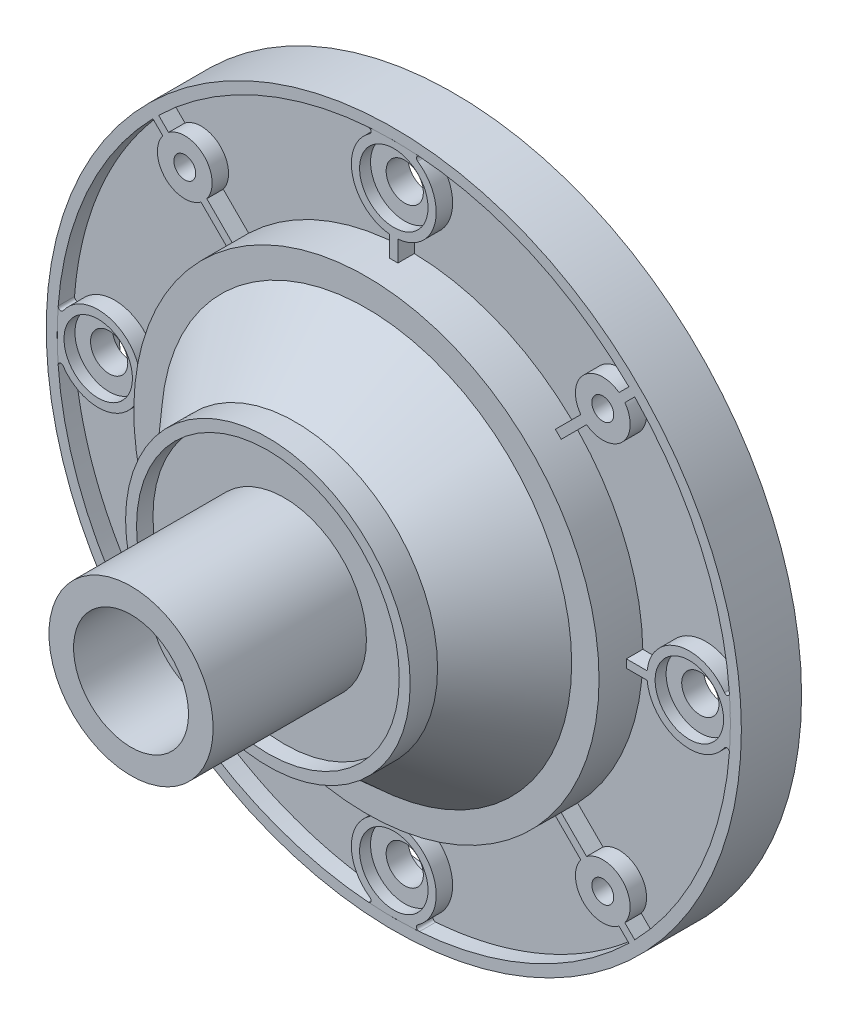
from build123d import *
from build123d.topology import SkipClean

# Parameters (mm, degrees)
SKETCH_1_R                = 63.5
EXTRUDE_1_DEPTH           = 11
SKETCH_2_R                = 42.5
EXTRUDE_2_DEPTH           = 5
SKETCH_3_R                = 26
EXTRUDE_3_DEPTH           = 18
SKETCH_4_R                = 37.5
SKETCH_5_R                = 26
SKETCH_6_R                = 15
EXTRUDE_4_DEPTH           = 25
SKETCH_7_R                = 61.5
CUT_EXTRUDE_1_DEPTH       = 6
SKETCH_9_R                = 37.5
SKETCH_9_R_2              = 35.5
EXTRUDE_1_2_DEPTH         = 3
SKETCH_12_R               = 12
EXTRUDE_5_DEPTH           = 19
SKETCH_13_R               = 8.5
CUT_EXTRUDE_3_DEPTH       = 103.301026388
SKETCH_14_R               = 10.5
CUT_EXTRUDE_4_DEPTH       = 14
CUT_EXTRUDE_START         = -3
SKETCH_15_R               = 24
SKETCH_15_R_2             = 15
CUT_EXTRUDE_5_DEPTH       = 3
CUT_EXTRUDE_START_2       = -8
SKETCH_16_R               = 40.5
SKETCH_16_R_2             = 37.5
CUT_EXTRUDE_6_DEPTH       = 8
SKETCH_17_R               = 61.5
SKETCH_17_R_2             = 42.5
CUT_EXTRUDE_7_DEPTH       = 3
SKETCH_18_R               = 5
EXTRUDE_6_DEPTH           = 3
RIB_1_REACH               = 109.45
SKETCH_19_WALL_W          = 220.843959406
SKETCH_19_WALL_H          = 1.5
SKETCH_20_W               = 19.666237603
SKETCH_20_H               = 3
EXTRUDE_2_2_DEPTH         = 0.75
PATTERN_CIRCULAR_2_COUNT  = 4
HOLE_WIZARD_1_D           = 6.8
HOLE_WIZARD_1_CBORE_D     = 12.5
HOLE_WIZARD_1_CBORE_DEPTH = 2
HOLE_WIZARD_2_D           = 4
EXTRUDE_START             = 1
SKETCH_26_R               = 5.25
SKETCH_26_R_2             = 3.4
EXTRUDE_7_DEPTH           = 1
PATTERN_CIRCULAR_3_COUNT  = 4
RIB_4_REACH               = 109.45
SKETCH_29_WALL_W          = 241.801402874
SKETCH_29_WALL_H          = 1
PATTERN_CIRCULAR_4_COUNT  = 8
EXTRUDE_8_DEPTH           = 12
PATTERN_CIRCULAR_5_COUNT  = 4


# Read off the part's stored shape, not the designer's step: 切除-拉伸2
with BuildPart() as part:
    # 草图1 → Extrude 1 (new body)
    with BuildSketch(Plane.XY):
        Circle(SKETCH_1_R)
    extrude(amount=EXTRUDE_1_DEPTH)

    # 草图2 → Extrude 2 (add)
    with BuildSketch(Plane.XY.offset(11)):
        Circle(SKETCH_2_R)
    extrude(amount=EXTRUDE_2_DEPTH)

    # 草图3 → 凸台-拉伸3 (add)
    with BuildSketch(Plane.XY.offset(16)):
        Circle(SKETCH_3_R)
    extrude(amount=EXTRUDE_3_DEPTH)

    # 草图4 → 放样1 section 0
    with BuildSketch(Plane.XY.offset(16)):
        Circle(SKETCH_4_R)
    # 草图5 → 放样1 section 1
    with BuildSketch(Plane.XY.offset(29)):
        Circle(SKETCH_5_R)
    loft()

    # 草图6 → 凸台-拉伸4 (add)
    with BuildSketch(Plane.XY.offset(34)):
        Circle(SKETCH_6_R)
    extrude(amount=EXTRUDE_4_DEPTH)

    # 草图7 → 切除-拉伸1 (cut)
    with BuildSketch(Plane(origin=(0, 0, 0), x_dir=(-1, 0, 0), z_dir=(0, 0, -1))):
        Circle(SKETCH_7_R)
    extrude(amount=-CUT_EXTRUDE_1_DEPTH, mode=Mode.SUBTRACT)

    # 草图9 → Extrude 1 2 (add)
    with BuildSketch(Plane(origin=(0, 0, 6), x_dir=(-1, 0, 0), z_dir=(0, 0, -1))):
        Circle(SKETCH_9_R)
        Circle(SKETCH_9_R_2, mode=Mode.SUBTRACT)
    extrude(amount=EXTRUDE_1_2_DEPTH)

    # 切除-拉伸2 outline → 切除-拉伸2 (revolve, cut)
    with SkipClean():  # the faces are left unmerged after this step: merging them gives an invalid solid
        with BuildSketch(Plane.XZ):
            Polygon((0, 6), (35.5, 6), (35.5, 15.242338268), (23.329760776, 29), (0, 29), align=None)
        revolve(axis=Axis((0, 0, 0), (0, 0, 1)), mode=Mode.SUBTRACT)

    # 草图12 → 凸台-拉伸5 (add)
    with SkipClean():  # the faces are left unmerged after this step: merging them gives an invalid solid
        with BuildSketch(Plane(origin=(0, 0, 29), x_dir=(-1, 0, 0), z_dir=(0, 0, -1))):
            Circle(SKETCH_12_R)
        extrude(amount=EXTRUDE_5_DEPTH)

    # 草图13 → 切除-拉伸3 (cut, through all)
    with SkipClean():  # the faces are left unmerged after this step: merging them gives an invalid solid
        with BuildSketch(Plane(origin=(0, 0, 10), x_dir=(-1, 0, 0), z_dir=(0, 0, -1))):
            Circle(SKETCH_13_R)
        extrude(amount=-CUT_EXTRUDE_3_DEPTH, mode=Mode.SUBTRACT)

    # 草图14 → 切除-拉伸4 (cut)
    with SkipClean():  # the faces are left unmerged after this step: merging them gives an invalid solid
        with BuildSketch(Plane.XY.offset(59)):
            Circle(SKETCH_14_R)
        extrude(amount=-CUT_EXTRUDE_4_DEPTH, mode=Mode.SUBTRACT)

    # 草图15 → 切除-拉伸5 (cut)
    with SkipClean():  # the faces are left unmerged after this step: merging them gives an invalid solid
        with BuildSketch(Plane.XY.offset(34).offset(CUT_EXTRUDE_START)):
            Circle(SKETCH_15_R)
            Circle(SKETCH_15_R_2, mode=Mode.SUBTRACT)
        extrude(amount=CUT_EXTRUDE_5_DEPTH, mode=Mode.SUBTRACT)

    # 草图16 → 切除-拉伸6 (cut)
    with SkipClean():  # the faces are left unmerged after this step: merging them gives an invalid solid
        with BuildSketch(Plane(origin=(0, 0, 6), x_dir=(-1, 0, 0), z_dir=(0, 0, -1)).offset(CUT_EXTRUDE_START_2)):
            Circle(SKETCH_16_R)
            with Locations(Location((0, 0, 0), (0, 0, 180))):
                Circle(SKETCH_16_R_2, mode=Mode.SUBTRACT)
        extrude(amount=CUT_EXTRUDE_6_DEPTH, mode=Mode.SUBTRACT)

    # 草图17 → 切除-拉伸7 (cut)
    with BuildSketch(Plane.XY.offset(11).offset(CUT_EXTRUDE_START)):
        with Locations(Location((0, 0, 0), (0, 0, 180))):
            Circle(SKETCH_17_R)
        Circle(SKETCH_17_R_2, mode=Mode.SUBTRACT)
    extrude(amount=CUT_EXTRUDE_7_DEPTH, mode=Mode.SUBTRACT)

    # 草图18 → 凸台-拉伸6 (add)
    with BuildSketch(Plane.XY.offset(8)):
        with Locations((-38.183766184, 38.183766184)):
            Circle(SKETCH_18_R)
        with BuildLine():
            ThreePointArc((-4.364482597, 60.404201094), (-5.23e-06, 46.25), (4.364491241, 60.404195204))
            ThreePointArc((4.364491241, 60.404195204), (4.172729373, 60.978451055), (4.674967073, 61.316533425))
            ThreePointArc((4.674967073, 61.316533425), (0.000154332, 61.494492342), (-4.674659303, 61.31655689))
            ThreePointArc((-4.674659303, 61.31655689), (-4.17267191, 60.97831544), (-4.364482597, 60.404201094))
        make_face()
    extrude_6 = extrude(amount=EXTRUDE_6_DEPTH)

    # 草图19 wall → 筋1 (add, up to next)
    with BuildSketch(Plane(origin=(0, 44.278008664, 11), x_dir=(0, -1, 0), z_dir=(0, 0, -1)), mode=Mode.PRIVATE) as rib_1_sk1:
        Rectangle(SKETCH_19_WALL_W, SKETCH_19_WALL_H)
    rib_1_tool1 = extrude(rib_1_sk1.sketch, amount=RIB_1_REACH, mode=Mode.PRIVATE) - part.part
    rib_1 = rib_1_tool1.solids().sort_by_distance((0, 44.278008664, 11))[0]
    add(rib_1)

    # 草图20 → Extrude 2 2 (add, symmetric)
    with BuildSketch(Plane(origin=(0, 0, 0), x_dir=(-0.7071067811865487, 0.7071067811865465, 0), z_dir=(-0.7071067811865465, -0.7071067811865487, 0))):
        with Locations((51.80063815, -9.5)):
            Rectangle(SKETCH_20_W, SKETCH_20_H)
    extrude_2_2 = extrude(amount=EXTRUDE_2_2_DEPTH, both=True)

    # 阵列(圆周)2: 凸台-拉伸6, 筋1, Extrude 2 2 ×4 about axis
    pattern_circular_2_axis = Axis((0, 0, 0), (0, 0, 1))
    add([extrude_6.rotate(pattern_circular_2_axis, i * 360 / PATTERN_CIRCULAR_2_COUNT) for i in range(1, PATTERN_CIRCULAR_2_COUNT)])
    add([rib_1.rotate(pattern_circular_2_axis, i * 360 / PATTERN_CIRCULAR_2_COUNT) for i in range(1, PATTERN_CIRCULAR_2_COUNT)])
    add([extrude_2_2.rotate(pattern_circular_2_axis, i * 360 / PATTERN_CIRCULAR_2_COUNT) for i in range(1, PATTERN_CIRCULAR_2_COUNT)])

    # 孔1 (through all)
    with Locations(Plane.XY.offset(11)):
        with Locations((0, 54), (54, 0), (0, -54), (-54, 0)):
            CounterBoreHole(HOLE_WIZARD_1_D / 2, HOLE_WIZARD_1_CBORE_D / 2, HOLE_WIZARD_1_CBORE_DEPTH)

    # 孔2 (through all)
    with Locations(Plane.XY.offset(11)):
        with Locations((38.183766184, 38.183766184), (38.183766184, -38.183766184), (-38.183766184, -38.183766184), (-38.183766184, 38.183766184)):
            Hole(HOLE_WIZARD_2_D / 2)

    # 草图26 → 凸台-拉伸7 (add)
    with BuildSketch(Plane(origin=(0, 0, 6), x_dir=(-1, 0, 0), z_dir=(0, 0, -1)).offset(EXTRUDE_START)):
        with Locations((0, 54)):
            Circle(SKETCH_26_R)
        with Locations(Location((0, 54, 0), (0, 0, 180))):
            Circle(SKETCH_26_R_2, mode=Mode.SUBTRACT)
    extrude_7 = extrude(amount=-EXTRUDE_7_DEPTH)

    # 阵列(圆周)3: 凸台-拉伸7 ×4 about axis
    with SkipClean():  # the faces are left unmerged after this step: merging them gives an invalid solid
        pattern_circular_3_axis = Axis((0, 0, 0), (0, 0, 1))
        for i in range(1, PATTERN_CIRCULAR_3_COUNT):
            add(extrude_7.rotate(pattern_circular_3_axis, i * 360 / PATTERN_CIRCULAR_3_COUNT))

    # 草图29 wall → 筋4 (add, up to next)
    with BuildSketch(Plane(origin=(0, 24.018719671, 11), x_dir=(0, 1, 0), z_dir=(0, 0, 1)), mode=Mode.PRIVATE) as rib_4_sk1:
        Rectangle(SKETCH_29_WALL_W, SKETCH_29_WALL_H)
    rib_4_tool1 = extrude(rib_4_sk1.sketch, amount=RIB_4_REACH, mode=Mode.PRIVATE) - part.part
    rib_4 = rib_4_tool1.solids().sort_by_distance((0, 24.018719671, 11))[0]
    add(rib_4)

    # 阵列(圆周)4: 筋4 ×8 about axis
    with SkipClean():  # the faces are left unmerged after this step: merging them gives an invalid solid
        pattern_circular_4_axis = Axis((0, 0, 0), (0, 0, 1))
        for i in range(1, PATTERN_CIRCULAR_4_COUNT):
            add(rib_4.rotate(pattern_circular_4_axis, i * 360 / PATTERN_CIRCULAR_4_COUNT))
    add(part.part.scale(1), mode=Mode.REPLACE)  # the faces are merged on a copy

    # 草图30 → 凸台-拉伸8 (add)
    with BuildSketch(Plane.XY.offset(3)):
        with BuildLine():
            ThreePointArc((-28.387596195, 21.316528383), (-25.102290732, 25.102290732), (-21.316528383, 28.387596195))
            Line((-21.316528383, 28.387596195), (-22.744211146, 29.815278958))
            ThreePointArc((-22.744211146, 29.815278958), (-26.516504294, 26.516504294), (-29.815278958, 22.744211146))
            Line((-29.815278958, 22.744211146), (-28.387596195, 21.316528383))
        make_face()
    extrude_8 = extrude(amount=-EXTRUDE_8_DEPTH)

    # 阵列(圆周)5: 凸台-拉伸8 ×4 about axis
    pattern_circular_5_axis = Axis((0, 0, 0), (0, 0, 1))
    for i in range(1, PATTERN_CIRCULAR_5_COUNT):
        add(extrude_8.rotate(pattern_circular_5_axis, i * 360 / PATTERN_CIRCULAR_5_COUNT))


solid = part.part
